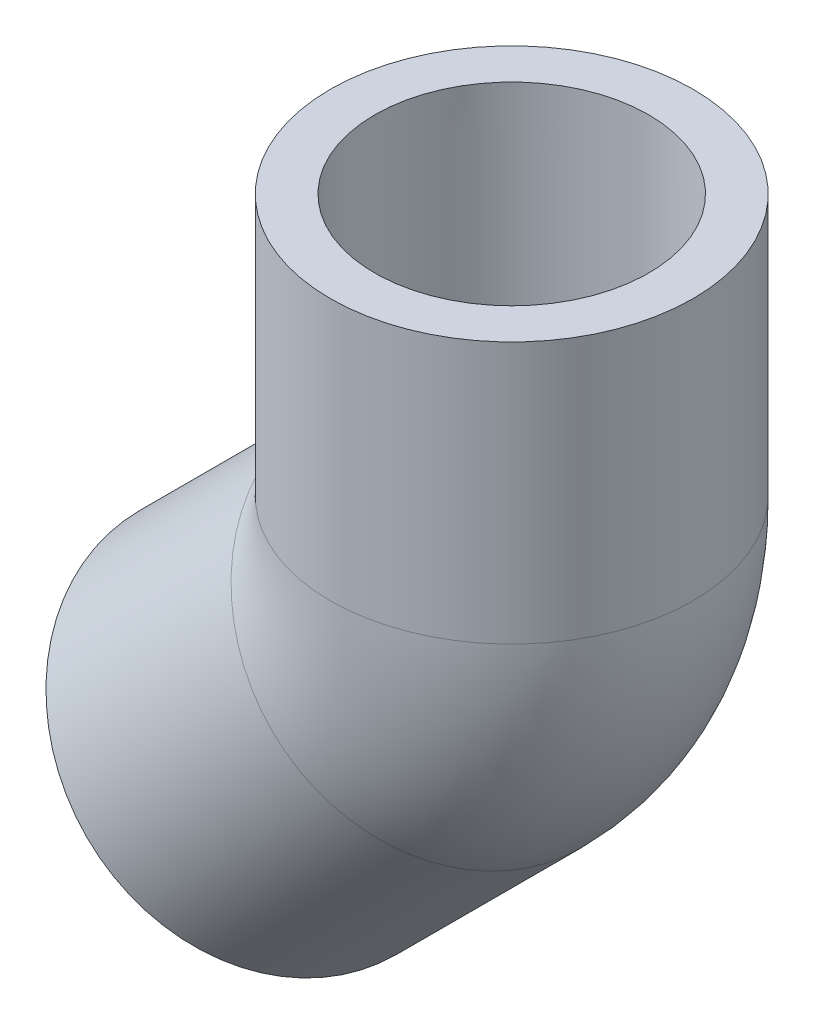
from build123d import *

# Parameters (mm, degrees)
SKETCH3_R   = 17.78
SKETCH3_R_2 = 9.4234


with BuildPart() as part:
    # Sketch1 → Revolve1 (revolve)
    with BuildSketch(Plane.XY):
        Polygon((-11.315122713, -36.459839852), (6.824994652, -18.319722487), (3.645983985, -15.14071182), (-14.386370306, -33.388592258), align=None)
    revolve(axis=Axis((-23.887481282, -23.887481282, 0), (0.707106781186549, 0.7071067811865461, 0)))



with BuildPart() as body_2:
    # Sketch2 → Revolve2 (revolve)
    with BuildSketch(Plane.XY):
        Polygon((13.4366, 33.782), (13.2842, 8.128), (17.78, 8.128), (17.78, 33.782), align=None)
    revolve(axis=Axis((0, 0, 0), (0, 1, 0)))


with BuildPart() as part_1:
    add(part.part)

    add(body_2.part)  # Sweep1 merges body 2
    # Sweep1: sweep along a path in Sketch4
    with BuildLine(Plane.XY) as sweep1_path:
        ThreePointArc((-5.747363917, -5.747363917), (-1.493691216, 0.61870716), (0, 8.128))
    # Sketch3 → Sweep1 (sweep)
    with BuildSketch(Plane(origin=(-5.747363917, -5.747363917, 0), x_dir=(0, 0, -1), z_dir=(0.7071067811865488, 0.7071067811865464, 0))):
        Circle(SKETCH3_R)
        Circle(SKETCH3_R_2, mode=Mode.SUBTRACT)
    sweep(path=sweep1_path.line)


solid = part_1.part
